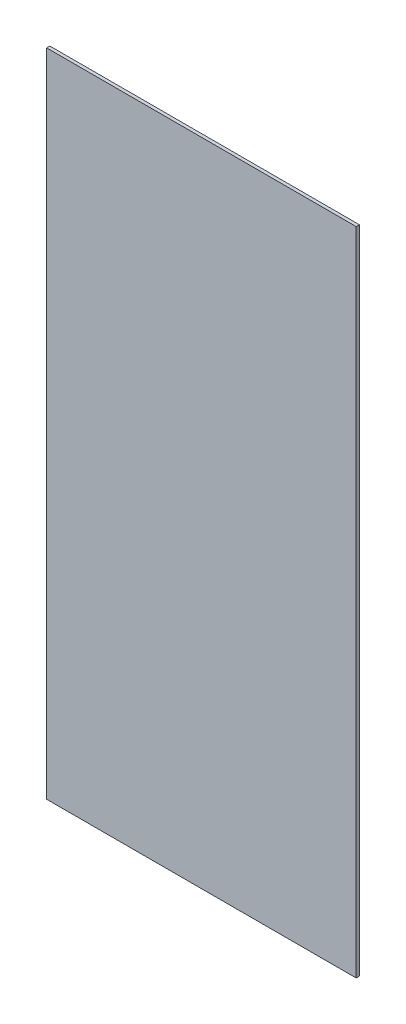
from build123d import *

# Parameters (mm, degrees)
SKETCH1_W           = 290
SKETCH1_H           = 609.6
BOSS_EXTRUDE1_DEPTH = 3


with BuildPart() as part:
    # Sketch1 → Boss-Extrude1 (new body)
    with BuildSketch(Plane.XY):
        Rectangle(SKETCH1_W, SKETCH1_H)
    extrude(amount=BOSS_EXTRUDE1_DEPTH)


solid = part.part
